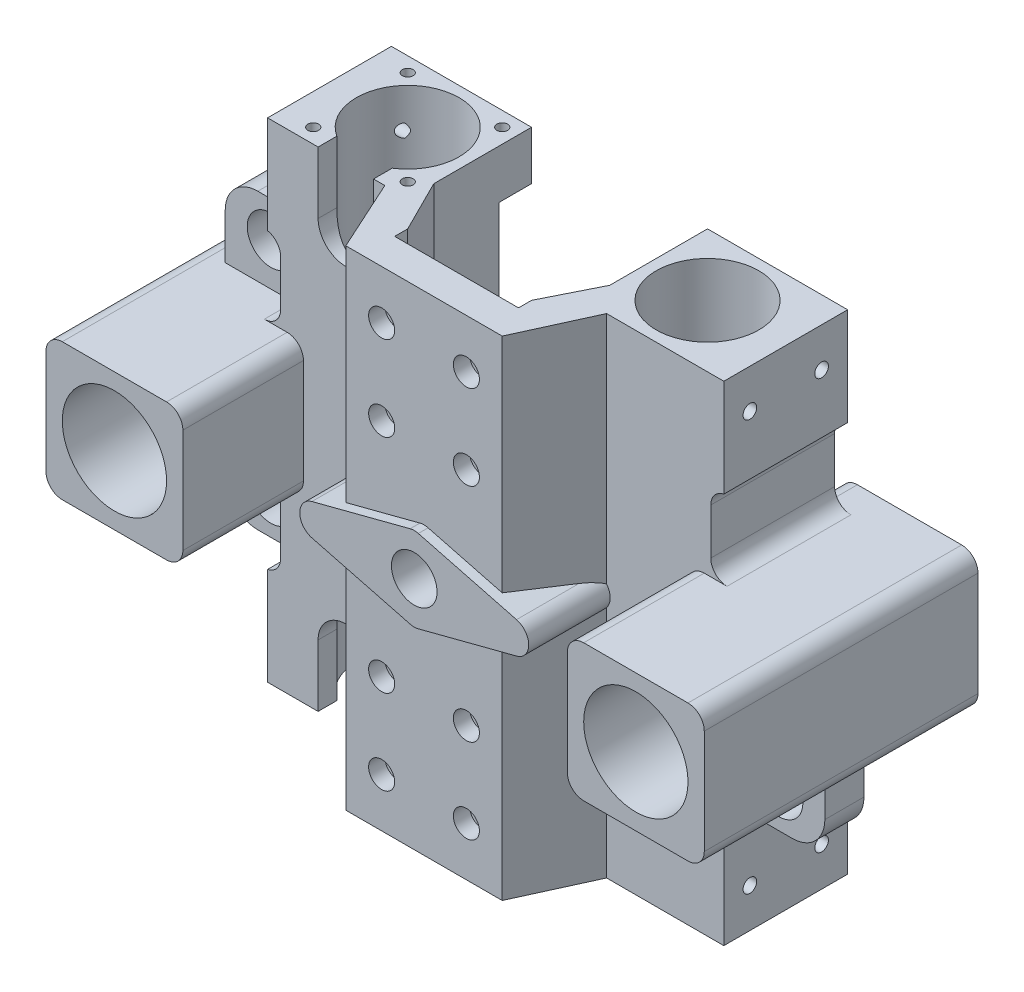
from build123d import *

# Parameters (mm, degrees)
EXTRUDE_1_DEPTH             = 75
EXTRUDE_2_DEPTH             = 3
EXTRUDE_2_DIRECTION_2_REACH = 120.849
FILLET_1_R                  = 5
SKETCH_3_R                  = 7
CUT_EXTRUDE_1_DEPTH         = 121.391029566
SKETCH_5_R                  = 12.75
CUT_EXTRUDE_2_DEPTH         = 3
HOLE_WIZARD_1_D             = 4.5
HOLE_WIZARD_1_CBORE_D       = 8
HOLE_WIZARD_1_CBORE_DEPTH   = 5
SKETCH_8_R                  = 15.75
CUT_EXTRUDE_3_DEPTH         = 178.112958306
CUT_EXTRUDE_4_REACH         = 111.403
CUT_EXTRUDE_4_END_RADIUS    = 15.75
SKETCH_11_W                 = 42
SKETCH_11_H                 = 42
EXTRUDE_3_DEPTH             = 84
SKETCH_12_R                 = 16
CUT_EXTRUDE_5_DEPTH         = 152.267974188
SKETCH_13_W                 = 22
SKETCH_13_H                 = 24
EXTRUDE_4_DEPTH             = 12
SKETCH_14_W                 = 26
SKETCH_14_H                 = 24
CUT_EXTRUDE_6_DEPTH         = 9
SKETCH_15_W                 = 26
SKETCH_15_H                 = 24
CUT_EXTRUDE_7_DEPTH         = 17
FILLET_2_R                  = 5
SKETCH_16_R                 = 7.25
CUT_EXTRUDE_8_DEPTH         = 134.947751064
FILLET_3_R                  = 10
M4X0_7_1_AT_2_COUNT         = 2
M4X0_7_1_AT_2_PITCH         = 29
M4X0_7_1_AT_3_COUNT         = 2
M4X0_7_1_AT_3_PITCH         = 41.012193309
M4X0_7_1_AT_4_COUNT         = 2
M4X0_7_1_AT_4_PITCH         = 29
M5X0_8_1_AT_2_COUNT         = 2
M5X0_8_1_AT_2_PITCH         = 22
M5X0_8_1_AT_3_COUNT         = 2
M5X0_8_1_AT_3_PITCH         = 127.906215643
M5X0_8_1_AT_4_COUNT         = 2
M5X0_8_1_AT_4_PITCH         = 126
SKETCH_21_W                 = 4
SKETCH_21_H                 = 24
CUT_EXTRUDE_9_DEPTH         = 135.294452659
FILLET_4_R                  = 5
CUT_EXTRUDE_10_DEPTH        = 60
FILLET_5_R                  = 5
EXTRUDE_5_DEPTH             = 25
FILLET_6_R                  = 5
SKETCH_25_W                 = 4
SKETCH_25_H                 = 24
CUT_EXTRUDE_11_DEPTH        = 9
SKETCH_26_W                 = 4
SKETCH_26_H                 = 24
CUT_EXTRUDE_12_DEPTH        = 17
FILLET_7_R                  = 5
SKETCH_27_R                 = 15.75
CUT_EXTRUDE_13_DEPTH        = 196.770273612


with BuildPart() as part:
    # 草图1 → 凸台-拉伸1 (new, symmetric)
    with BuildSketch(Plane(origin=(0, 0, 0), x_dir=(1, 0, 0), z_dir=(0, 1, 0))):
        Polygon((-70, 0), (-27, 0), (-27, -30), (-19, -46), (-19, -50), (19, -50), (19, -46), (27, -30), (27, 0), (70, 0), (70, -38), (34.025977622, -38), (24, -60), (-24, -60), (-34.025977622, -38), (-70, -38), align=None)
    extrude(amount=EXTRUDE_1_DEPTH, both=True)

    # 草图2 → 凸台-拉伸2 (add)
    with BuildSketch(Plane.XY.offset(60)):
        Polygon((-50, 0), (0, 13), (50, 0), (0, -13), align=None)
    extrude(amount=EXTRUDE_2_DEPTH)

    # 凸台-拉伸2 direction 2: up to this face of the body (flat: up to its plane)
    extrude_2_direction_2_end = Plane(part.part.faces().sort_by_distance((0, 0, 50))[0])
    # 草图2 → 凸台-拉伸2 direction 2 (add, up to the picked face)
    with BuildSketch(Plane.XY.offset(60), mode=Mode.PRIVATE) as extrude_2_direction_2_sk1:
        Polygon((-50, 0), (0, 13), (50, 0), (0, -13), align=None)
    extrude_2_direction_2_tool1 = split(extrude(extrude_2_direction_2_sk1.sketch, amount=-EXTRUDE_2_DIRECTION_2_REACH, mode=Mode.PRIVATE), bisect_by=extrude_2_direction_2_end, keep=Keep.BOTH, mode=Mode.PRIVATE)
    add(extrude_2_direction_2_tool1.solids().sort_by(Axis((0, 0, 60), (0, 0, -1)))[0])

    # 圆角1
    fillet_1_edges = [part.edges().sort_by_distance(p)[0] for p in [
        (0, -13, 61.5),
        (0, 13, 61.5),
    ]]
    fillet(fillet_1_edges, radius=FILLET_1_R)

    # 草图3 → 切除-拉伸1 (cut, through all)
    with BuildSketch(Plane.XY.offset(63)):
        Circle(SKETCH_3_R)
    extrude(amount=-CUT_EXTRUDE_1_DEPTH, mode=Mode.SUBTRACT)

    # 草图5 → 切除-拉伸2 (cut)
    with BuildSketch(Plane(origin=(0, 0, 50), x_dir=(-1, 0, 0), z_dir=(0, 0, -1))):
        Circle(SKETCH_5_R)
    extrude(amount=-CUT_EXTRUDE_2_DEPTH, mode=Mode.SUBTRACT)

    # 孔1 (through all)
    with Locations(Plane.XY.offset(60)):
        with Locations((-13, 34), (-13, 60), (13, 60), (13, 34), (13, -34), (13, -60), (-13, -60), (-13, -34)):
            CounterBoreHole(HOLE_WIZARD_1_D / 2, HOLE_WIZARD_1_CBORE_D / 2, HOLE_WIZARD_1_CBORE_DEPTH)

    # 草图8 → 切除-拉伸3 (cut, through all)
    with BuildSketch(Plane(origin=(0, 75, 0), x_dir=(1, 0, 0), z_dir=(0, 1, 0))):
        with Locations(Location((-46, -19, 0), (0, 0, 270))):
            Circle(SKETCH_8_R)
        with Locations(Location((46, -19, 0), (0, 0, 90))):
            Circle(SKETCH_8_R)
    extrude(amount=-CUT_EXTRUDE_3_DEPTH, mode=Mode.SUBTRACT)

    # 切除-拉伸4: up to this cylinder (the profile starts outside it)
    cut_extrude_4_end = Plane(origin=(-46, 0, 19), z_dir=(0, 1, 0)) * Cylinder(CUT_EXTRUDE_4_END_RADIUS, 379.489936, mode=Mode.PRIVATE)
    # 草图10 → 切除-拉伸4 (cut, up to the surface)
    with BuildSketch(Plane.XY.offset(38), mode=Mode.PRIVATE) as cut_extrude_4_sk1:
        with BuildLine():
            Line((-54.5, -75), (-37.5, -75))
            Line((-37.5, -75), (-37.5, -56))
            ThreePointArc((-37.5, -56), (-46, -47.5), (-54.5, -56))
            Line((-54.5, -56), (-54.5, -75))
        make_face()
    cut_extrude_4_tool1 = extrude(cut_extrude_4_sk1.sketch, amount=-CUT_EXTRUDE_4_REACH, mode=Mode.PRIVATE) - cut_extrude_4_end
    add(cut_extrude_4_tool1.solids().sort_by_distance((-46, -62.091968, 38))[0], mode=Mode.SUBTRACT)
    # 草图10 → 切除-拉伸4 (cut, up to the surface)
    with BuildSketch(Plane.XY.offset(38), mode=Mode.PRIVATE) as cut_extrude_4_sk2:
        with BuildLine():
            Line((-54.5, 75), (-37.5, 75))
            Line((-37.5, 75), (-37.5, 56))
            ThreePointArc((-37.5, 56), (-46, 47.5), (-54.5, 56))
            Line((-54.5, 56), (-54.5, 75))
        make_face()
    cut_extrude_4_tool2 = extrude(cut_extrude_4_sk2.sketch, amount=-CUT_EXTRUDE_4_REACH, mode=Mode.PRIVATE) - cut_extrude_4_end
    add(cut_extrude_4_tool2.solids().sort_by_distance((-46, 62.091968, 38))[0], mode=Mode.SUBTRACT)

    # 草图11 → 凸台-拉伸3 (add)
    with BuildSketch(Plane(origin=(0, 0, -9), x_dir=(-1, 0, 0), z_dir=(0, 0, -1))):
        with Locations((80, 0)):
            Rectangle(SKETCH_11_W, SKETCH_11_H)
        with Locations((-80, 0)):
            Rectangle(SKETCH_11_W, SKETCH_11_H)
    extrude(amount=-EXTRUDE_3_DEPTH)

    # 草图12 → 切除-拉伸5 (cut, through all)
    with BuildSketch(Plane.XY.offset(75)):
        with Locations((-80, 0)):
            Circle(SKETCH_12_R)
        with Locations(Location((80, 0, 0), (0, 0, 180))):
            Circle(SKETCH_12_R)
    extrude(amount=-CUT_EXTRUDE_5_DEPTH, mode=Mode.SUBTRACT)

    # 草图13 → 凸台-拉伸4 (add)
    with BuildSketch(Plane(origin=(0, 0, 17), x_dir=(-1, 0, 0), z_dir=(0, 0, -1))):
        with Locations((81, 33)):
            Rectangle(SKETCH_13_W, SKETCH_13_H)
        with Locations((81, -33)):
            Rectangle(SKETCH_13_W, SKETCH_13_H)
        with Locations((-81, -33)):
            Rectangle(SKETCH_13_W, SKETCH_13_H)
    extrude(amount=-EXTRUDE_4_DEPTH)

    # 草图14 → 切除-拉伸6 (cut)
    with BuildSketch(Plane.XY.offset(38)):
        with Locations((-79, 33)):
            Rectangle(SKETCH_14_W, SKETCH_14_H)
        with Locations((79, 33)):
            Rectangle(SKETCH_14_W, SKETCH_14_H)
        with Locations((-79, -33)):
            Rectangle(SKETCH_14_W, SKETCH_14_H)
    extrude(amount=-CUT_EXTRUDE_6_DEPTH, mode=Mode.SUBTRACT)

    # 草图15 → 切除-拉伸7 (cut)
    with BuildSketch(Plane(origin=(0, 0, 0), x_dir=(-1, 0, 0), z_dir=(0, 0, -1))):
        with Locations((79, 33)):
            Rectangle(SKETCH_15_W, SKETCH_15_H)
        with Locations((79, -33)):
            Rectangle(SKETCH_15_W, SKETCH_15_H)
        with Locations((-79, 33)):
            Rectangle(SKETCH_15_W, SKETCH_15_H)
    extrude(amount=-CUT_EXTRUDE_7_DEPTH, mode=Mode.SUBTRACT)

    # 圆角2
    # the kernel refuses this fillet: 5 mm, written as the material it adds along each edge
    with BuildSketch(Plane(origin=(-66, 21, 38), x_dir=(0, 1, 0), z_dir=(0, 0, -1)), Plane(origin=(66, 21, 38), x_dir=(1, 0, 0), z_dir=(0, 0, -1)), Plane(origin=(-66, -21, 38), x_dir=(-1, 0, 0), z_dir=(0, 0, -1))) as fillet_2_piece_1:
        with BuildLine():
            CenterArc((FILLET_2_R, -FILLET_2_R), FILLET_2_R, 90, 90)
            Line((0, -FILLET_2_R), (0, 0))
            Line((0, 0), (FILLET_2_R, 0))
        make_face()
    extrude(amount=21.5)
    with BuildSketch(Plane(origin=(-66, 45, 38), x_dir=(0, -1, 0), z_dir=(0, 0, -1))) as fillet_2_piece_2:
        with BuildLine():
            CenterArc((4.898979486, 5), FILLET_2_R, 191.536959033, 78.463040967)
            Line((0, 4), (0, 0))
            Line((0, 0), (4.898979486, 0))
        make_face()
    extrude(amount=21.247448714)
    with BuildSketch(Plane(origin=(66, 45, 38), x_dir=(1.0, -1.5685230891899252e-12, 0), z_dir=(0, 0, -1))) as fillet_2_piece_3:
        with BuildLine():
            CenterArc((5, 4.898979486), FILLET_2_R, 180, 78.463040967)
            Line((0, 4.898979486), (0, 0))
            Line((0, 0), (4, 0))
        make_face()
    extrude(amount=21.247448714)
    with BuildSketch(Plane(origin=(-66, -45, 38), x_dir=(0, 1, 0), z_dir=(0, 0, -1))) as fillet_2_piece_4:
        with BuildLine():
            CenterArc((4.898979486, -5), FILLET_2_R, 90, 78.463040967)
            Line((0, -4), (0, 0))
            Line((0, 0), (4.898979486, 0))
        make_face()
    extrude(amount=21.247448714)
    with BuildSketch(Plane(origin=(-66, 45, 0), x_dir=(-1.0, -1.5685230891899197e-12, 0), z_dir=(0, 0, 1))) as fillet_2_piece_5:
        with BuildLine():
            CenterArc((5, 4.898979486), FILLET_2_R, 180, 78.463040967)
            Line((0, 4.898979486), (0, 0))
            Line((0, 0), (4, 0))
        make_face()
    extrude(amount=29.247448714)
    with BuildSketch(Plane(origin=(-66, 21, 0), x_dir=(0, 1, 0), z_dir=(0, 0, 1)), Plane(origin=(-66, -21, 0), x_dir=(-1, 0, 0), z_dir=(0, 0, 1)), Plane(origin=(66, 21, 0), x_dir=(1, 0, 0), z_dir=(0, 0, 1))) as fillet_2_piece_6:
        with BuildLine():
            CenterArc((FILLET_2_R, FILLET_2_R), FILLET_2_R, 180, 90)
            Line((0, FILLET_2_R), (0, 0))
            Line((0, 0), (FILLET_2_R, 0))
        make_face()
    extrude(amount=29.5)
    with BuildSketch(Plane(origin=(-66, -45, 0), x_dir=(0, 1, 0), z_dir=(0, 0, 1)), Plane(origin=(66, 45, 0), x_dir=(0, -1, 0), z_dir=(0, 0, 1))) as fillet_2_piece_7:
        with BuildLine():
            CenterArc((4.898979486, 5), FILLET_2_R, 191.536959033, 78.463040967)
            Line((0, 4), (0, 0))
            Line((0, 0), (4.898979486, 0))
        make_face()
    extrude(amount=29.247448714)

    # 草图16 → 切除-拉伸8 (cut, through all)
    with BuildSketch(Plane.XY.offset(29)):
        with Locations((-78, 34)):
            Circle(SKETCH_16_R)
        with Locations(Location((-78, -34, 0), (0, 0, 180))):
            Circle(SKETCH_16_R)
        with Locations(Location((78, -34, 0), (0, 0, 180))):
            Circle(SKETCH_16_R)
    extrude(amount=-CUT_EXTRUDE_8_DEPTH, mode=Mode.SUBTRACT)

    # 圆角3
    fillet_3_edges = [part.edges().sort_by_distance(p)[0] for p in [
        (-92, 45, 23),
        (-92, -45, 23),
        (92, -45, 23),
    ]]
    fillet(fillet_3_edges, radius=FILLET_3_R)

    # 草图17 → M4x0.7 螺纹孔1 (revolve, cut)
    with BuildSketch(Plane(origin=(-60.5, 75, 4.5), x_dir=(0, 0, 1), z_dir=(1, 0, 0))):
        Polygon((0, 0), (0, 11.091420021), (1.65, 10.1), (1.65, 0), align=None)
    m4x0_7_1 = revolve(axis=Axis((-60.5, 81.35, 4.5), (0, -1, 0)), mode=Mode.SUBTRACT)

    # M4x0.7 螺纹孔1 at 2: M4x0.7 螺纹孔1 ×2
    with Locations(*[(0, 0, i * M4X0_7_1_AT_2_PITCH) for i in range(1, M4X0_7_1_AT_2_COUNT)]):
        add(m4x0_7_1, mode=Mode.SUBTRACT)

    # M4x0.7 螺纹孔1 at 3: M4x0.7 螺纹孔1 ×2
    with Locations(*[Vector(0.7071067811865474, 0, 0.7071067811865477) * (i * M4X0_7_1_AT_3_PITCH) for i in range(1, M4X0_7_1_AT_3_COUNT)]):
        add(m4x0_7_1, mode=Mode.SUBTRACT)

    # M4x0.7 螺纹孔1 at 4: M4x0.7 螺纹孔1 ×2
    with Locations(*[(i * M4X0_7_1_AT_4_PITCH, 0, 0) for i in range(1, M4X0_7_1_AT_4_COUNT)]):
        add(m4x0_7_1, mode=Mode.SUBTRACT)

    # 镜向1: M4x0.7 螺纹孔1 across plane
    add(m4x0_7_1.mirror(Plane.ZX), mode=Mode.SUBTRACT)

    # 镜向1 copy 1 sketch → 镜向1 copy 1 (revolve, cut)
    with BuildSketch(Plane(origin=(-60.5, -75, 33.5), x_dir=(0, 0, 1), z_dir=(1, 0, 0))):
        Polygon((0, 0), (0, -11.091420021), (1.65, -10.1), (1.65, 0), align=None)
    revolve(axis=Axis((-60.5, -81.35, 33.5), (0, -1, 0)), mode=Mode.SUBTRACT)

    # 镜向1 copy 2 sketch → 镜向1 copy 2 (revolve, cut)
    with BuildSketch(Plane(origin=(-31.5, -75, 33.5), x_dir=(0, 0, 1), z_dir=(1, 0, 0))):
        Polygon((0, 0), (0, -11.091420021), (1.65, -10.1), (1.65, 0), align=None)
    revolve(axis=Axis((-31.5, -81.35, 33.5), (0, -1, 0)), mode=Mode.SUBTRACT)

    # 镜向1 copy 3 sketch → 镜向1 copy 3 (revolve, cut)
    with BuildSketch(Plane(origin=(-31.5, -75, 4.5), x_dir=(0, 0, 1), z_dir=(1, 0, 0))):
        Polygon((0, 0), (0, -11.091420021), (1.65, -10.1), (1.65, 0), align=None)
    revolve(axis=Axis((-31.5, -81.35, 4.5), (0, -1, 0)), mode=Mode.SUBTRACT)

    # 草图19 → M5x0.8 螺纹孔1 (revolve, cut)
    with BuildSketch(Plane(origin=(-70, -63, 8), x_dir=(0, 0, 1), z_dir=(0, 1, 0))):
        Polygon((0, 0), (0, 13.6618073), (2.1, 12.4), (2.1, 0), align=None)
    m5x0_8_1 = revolve(axis=Axis((-76.35, -63, 8), (1, 0, 0)), mode=Mode.SUBTRACT)

    # M5x0.8 螺纹孔1 at 2: M5x0.8 螺纹孔1 ×2
    with Locations(*[(0, 0, i * M5X0_8_1_AT_2_PITCH) for i in range(1, M5X0_8_1_AT_2_COUNT)]):
        add(m5x0_8_1, mode=Mode.SUBTRACT)

    # M5x0.8 螺纹孔1 at 3: M5x0.8 螺纹孔1 ×2
    with Locations(*[Vector(0, 0.9850967708412004, 0.1720010234802096) * (i * M5X0_8_1_AT_3_PITCH) for i in range(1, M5X0_8_1_AT_3_COUNT)]):
        add(m5x0_8_1, mode=Mode.SUBTRACT)

    # M5x0.8 螺纹孔1 at 4: M5x0.8 螺纹孔1 ×2
    with Locations(*[(0, i * M5X0_8_1_AT_4_PITCH, 0) for i in range(1, M5X0_8_1_AT_4_COUNT)]):
        add(m5x0_8_1, mode=Mode.SUBTRACT)

    # 镜向2: M5x0.8 螺纹孔1 across plane
    add(m5x0_8_1.mirror(Plane(origin=(0, 0, 0), x_dir=(0, 0, 1), z_dir=(1, 0, 0))), mode=Mode.SUBTRACT)

    # 镜向2 copy 1 sketch → 镜向2 copy 1 (revolve, cut)
    with BuildSketch(Plane(origin=(70, -63, 30), x_dir=(0, 0, 1), z_dir=(0, 1, 0))):
        Polygon((0, 0), (0, -13.6618073), (2.1, -12.4), (2.1, 0), align=None)
    revolve(axis=Axis((76.35, -63, 30), (1, 0, 0)), mode=Mode.SUBTRACT)

    # 镜向2 copy 2 sketch → 镜向2 copy 2 (revolve, cut)
    with BuildSketch(Plane(origin=(70, 63, 30), x_dir=(0, 0, 1), z_dir=(0, 1, 0))):
        Polygon((0, 0), (0, -13.6618073), (2.1, -12.4), (2.1, 0), align=None)
    revolve(axis=Axis((76.35, 63, 30), (1, 0, 0)), mode=Mode.SUBTRACT)

    # 镜向2 copy 3 sketch → 镜向2 copy 3 (revolve, cut)
    with BuildSketch(Plane(origin=(70, 63, 8), x_dir=(0, 0, 1), z_dir=(0, 1, 0))):
        Polygon((0, 0), (0, -13.6618073), (2.1, -12.4), (2.1, 0), align=None)
    revolve(axis=Axis((76.35, 63, 8), (1, 0, 0)), mode=Mode.SUBTRACT)

    # 草图21 → 切除-拉伸9 (cut, through all)
    with BuildSketch(Plane.XY.offset(38)):
        with Locations((68, 33)):
            Rectangle(SKETCH_21_W, SKETCH_21_H)
    extrude(amount=-CUT_EXTRUDE_9_DEPTH, mode=Mode.SUBTRACT)

    # 圆角4
    # the kernel refuses this fillet: 5 mm, written as the material it adds along each edge
    with BuildSketch(Plane(origin=(66, 21, 38), x_dir=(1, 0, 0), z_dir=(0, 0, -1))) as fillet_4_piece_1:
        with BuildLine():
            CenterArc((FILLET_4_R, -FILLET_4_R), FILLET_4_R, 90, 90)
            Line((0, -FILLET_4_R), (-FILLET_4_R * 0.02, -FILLET_4_R))
            Line((-FILLET_4_R * 0.02, -FILLET_4_R), (-FILLET_4_R * 0.02, FILLET_4_R * 0.02))
            Line((-FILLET_4_R * 0.02, FILLET_4_R * 0.02), (FILLET_4_R, FILLET_4_R * 0.02))
            Line((FILLET_4_R, FILLET_4_R * 0.02), (FILLET_4_R, 0))
        make_face()
    extrude(amount=38)
    with BuildSketch(Plane(origin=(66, 45, 38), x_dir=(1.0, -1.5702994460293248e-12, 0), z_dir=(0, 0, -1))) as fillet_4_piece_2:
        with BuildLine():
            CenterArc((5, 4.898979486), FILLET_4_R, 180, 78.463040967)
            Line((0, 4.898979486), (-0.1, 4.898979486))
            Line((-0.1, 4.898979486), (-0.1, 0))
            Line((-0.1, 0), (0, -0.1))
            ThreePointArc((0, -0.1), (2, -0.1), (3.98, -0.09797959))
            Line((3.98, -0.09797959), (4, 0))
        make_face()
    extrude(amount=38)

    # 草图22 → 切除-拉伸10 (cut, symmetric)
    with BuildSketch(Plane(origin=(0, 0, 0), x_dir=(1, 0, 0), z_dir=(0, 1, 0))):
        Polygon((-27, 0), (-37, 0), (-27, -10), align=None)
        Polygon((27, -10), (27, 0), (37, 0), align=None)
    extrude(amount=CUT_EXTRUDE_10_DEPTH, both=True, mode=Mode.SUBTRACT)

    # 圆角5
    fillet_5_edges = [part.edges().sort_by_distance(p)[0] for p in [
        (-101, -21, 33),
        (-59, -21, 56.5),
        (-59, -21, -4.5),
        (-59, 21, -4.5),
        (-59, 21, 56.5),
        (-101, 21, 33),
        (101, 21, 33),
        (59, 21, 56.5),
        (59, 21, -4.5),
        (59, -21, -4.5),
        (59, -21, 56.5),
        (101, -21, 33),
    ]]
    fillet(fillet_5_edges, radius=FILLET_5_R)

    # 草图23 → 凸台-拉伸5 (add)
    with BuildSketch(Plane.XY.offset(63)):
        Polygon((-50, 0), (-24, -6.76), (-24, 6.76), align=None)
        Polygon((50, 0), (24, 6.76), (24, -6.76), align=None)
    extrude(amount=-EXTRUDE_5_DEPTH)

    # 圆角6
    # the kernel refuses this fillet: 5 mm, written as the material it takes off along each edge
    with BuildSketch(Plane(origin=(50, 0, 38), x_dir=(-0.967822506788272, 0.25163385176495073, 0), z_dir=(0, 0, 1))) as fillet_6_piece_1_section:
        with BuildLine():
            CenterArc((FILLET_6_R * 3.84615384615, FILLET_6_R), FILLET_6_R, 119.148432396, 150.851567604)
            Line((FILLET_6_R * 3.35908003574, FILLET_6_R * 1.87336080929), (0, 0))
            Line((0, 0), (FILLET_6_R * 3.84615384615, 0))
        make_face()
    fillet_6_piece_1 = extrude(amount=73.076923077, mode=Mode.PRIVATE)
    fillet_6_piece_1 = split(fillet_6_piece_1, bisect_by=Plane(origin=(30.256649351, 0, 46.27103601), z_dir=(0.9099612708765429, 0, 0.4146932426562399)), keep=Keep.TOP, mode=Mode.PRIVATE)
    add(fillet_6_piece_1, mode=Mode.SUBTRACT)
    with BuildSketch(Plane(origin=(-50, 0, 38), x_dir=(0.967822506788272, -0.25163385176495034, 0), z_dir=(0, 0, 1))) as fillet_6_piece_2_section:
        with BuildLine():
            CenterArc((FILLET_6_R * 3.84615384615, FILLET_6_R), FILLET_6_R, 119.148432396, 150.851567604)
            Line((FILLET_6_R * 3.35908003574, FILLET_6_R * 1.87336080929), (0, 0))
            Line((0, 0), (FILLET_6_R * 3.84615384615, 0))
        make_face()
    fillet_6_piece_2 = extrude(amount=73.076923077, mode=Mode.PRIVATE)
    fillet_6_piece_2 = split(fillet_6_piece_2, bisect_by=Plane(origin=(-30.256649351, 0, 46.27103601), z_dir=(-0.9099612708765429, 0, 0.4146932426562399)), keep=Keep.TOP, mode=Mode.PRIVATE)
    add(fillet_6_piece_2, mode=Mode.SUBTRACT)

    # 草图25 → 切除-拉伸11 (cut)
    with BuildSketch(Plane.XY.offset(38)):
        with Locations((68, -33)):
            Rectangle(SKETCH_25_W, SKETCH_25_H)
    extrude(amount=-CUT_EXTRUDE_11_DEPTH, mode=Mode.SUBTRACT)

    # 草图26 → 切除-拉伸12 (cut)
    with BuildSketch(Plane(origin=(0, 0, 0), x_dir=(-1, 0, 0), z_dir=(0, 0, -1))):
        with Locations((-68, -33)):
            Rectangle(SKETCH_26_W, SKETCH_26_H)
    extrude(amount=-CUT_EXTRUDE_12_DEPTH, mode=Mode.SUBTRACT)

    # 圆角7
    # the kernel refuses this fillet: 5 mm, written as the material it adds along each edge
    with BuildSketch(Plane(origin=(66, -45, 38), x_dir=(1.0, 1.5809575870657174e-12, 0), z_dir=(0, 0, -1))) as fillet_7_piece_1:
        with BuildLine():
            CenterArc((5, -4.898979486), FILLET_7_R, 101.536959033, 78.463040967)
            Line((0, -4.898979486), (-0.1, -4.898979486))
            Line((-0.1, -4.898979486), (-0.1, 0))
            Line((-0.1, 0), (0, 0.1))
            ThreePointArc((0, 0.1), (2, 0.1), (3.98, 0.09797959))
            Line((3.98, 0.09797959), (4, 0))
        make_face()
    extrude(amount=21.247448714)
    with BuildSketch(Plane(origin=(66, -21, 38), x_dir=(0, -1, 0), z_dir=(0, 0, -1))) as fillet_7_piece_2:
        with BuildLine():
            CenterArc((FILLET_7_R, -FILLET_7_R), FILLET_7_R, 90, 90)
            Line((0, -FILLET_7_R), (-FILLET_7_R * 0.02, -FILLET_7_R))
            Line((-FILLET_7_R * 0.02, -FILLET_7_R), (-FILLET_7_R * 0.02, FILLET_7_R * 0.02))
            Line((-FILLET_7_R * 0.02, FILLET_7_R * 0.02), (FILLET_7_R, FILLET_7_R * 0.02))
            Line((FILLET_7_R, FILLET_7_R * 0.02), (FILLET_7_R, 0))
        make_face()
    extrude(amount=21.5)
    with BuildSketch(Plane(origin=(66, -45, 0), x_dir=(1.0, 1.561417661832321e-12, 0), z_dir=(0, 0, 1))) as fillet_7_piece_3:
        with BuildLine():
            CenterArc((5, 4.898979486), FILLET_7_R, 180, 78.463040967)
            Line((0, 4.898979486), (-0.1, 4.898979486))
            Line((-0.1, 4.898979486), (-0.1, 0))
            Line((-0.1, 0), (0, -0.1))
            ThreePointArc((0, -0.1), (2, -0.1), (3.98, -0.09797959))
            Line((3.98, -0.09797959), (4, 0))
        make_face()
    extrude(amount=29.247448714)
    with BuildSketch(Plane(origin=(66, -21, 0), x_dir=(0, -1, 0), z_dir=(0, 0, 1))) as fillet_7_piece_4:
        with BuildLine():
            CenterArc((FILLET_7_R, FILLET_7_R), FILLET_7_R, 180, 90)
            Line((0, FILLET_7_R), (-FILLET_7_R * 0.02, FILLET_7_R))
            Line((-FILLET_7_R * 0.02, FILLET_7_R), (-FILLET_7_R * 0.02, -FILLET_7_R * 0.02))
            Line((-FILLET_7_R * 0.02, -FILLET_7_R * 0.02), (FILLET_7_R, -FILLET_7_R * 0.02))
            Line((FILLET_7_R, -FILLET_7_R * 0.02), (FILLET_7_R, 0))
        make_face()
    extrude(amount=29.5)

    # 草图27 → 切除-拉伸13 (cut, through all)
    with BuildSketch(Plane(origin=(0, 75, 0), x_dir=(1, 0, 0), z_dir=(0, 1, 0))):
        with Locations(Location((-46, -19, 0), (0, 0, 302.662030563))):
            Circle(SKETCH_27_R)
        with Locations(Location((46, -19, 0), (0, 0, 90))):
            Circle(SKETCH_27_R)
    extrude(amount=-CUT_EXTRUDE_13_DEPTH, mode=Mode.SUBTRACT)


solid = part.part
